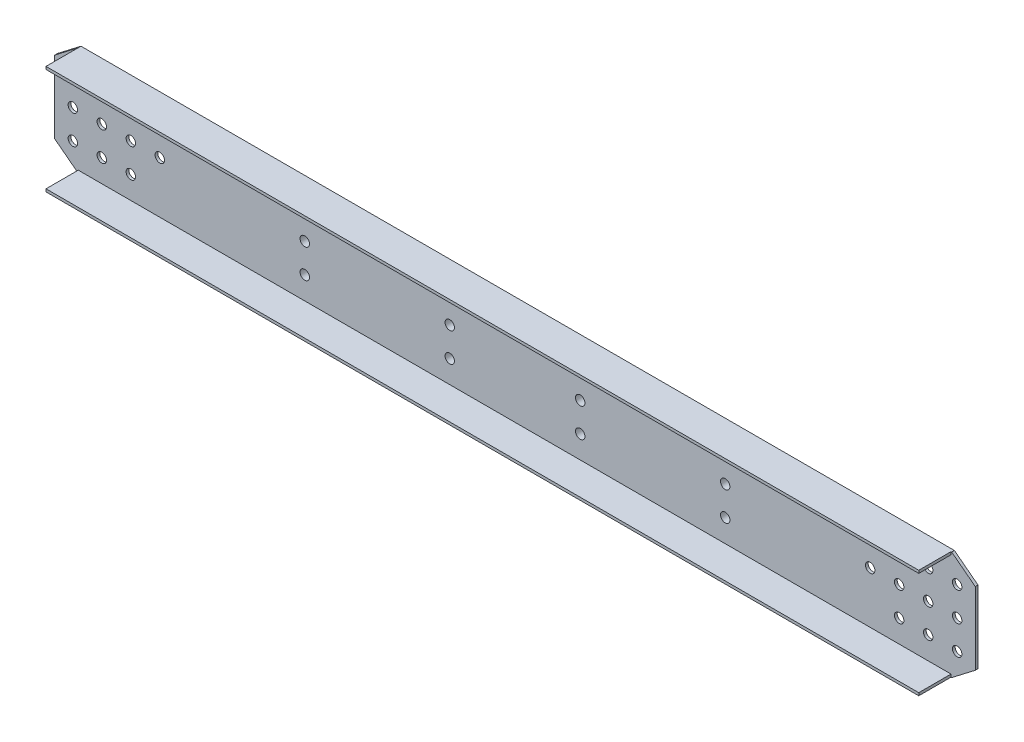
from build123d import *

# Parameters (mm, degrees)
SKETCH_1_R          = 13
EXTRUDE_637_DEPTH   = 7.5
SKETCH_2_W          = 2408.049034164
SKETCH_2_H          = 7.5
EXTRUDE_1_DEPTH     = 89
SKETCH_3_W          = 80
SKETCH_3_H          = 240
EXTRUDE_2_DEPTH     = 16
SKETCH_4_R          = 13
CUT_EXTRUDE_1_DEPTH = 1308.983562588


with BuildPart() as part:
    # 草图1 → Extrude 637 (new body)
    with BuildSketch(Plane.XY):
        Polygon((-1205, 0), (1205, 0), (1270, 50), (1270, 250), (1205, 300), (-1205, 300), (-1270, 250), (-1270, 50), align=None)
        with Locations((-1220, 230)):
            Circle(SKETCH_1_R, mode=Mode.SUBTRACT)
        with Locations((-1220, 150)):
            Circle(SKETCH_1_R, mode=Mode.SUBTRACT)
        with Locations((-1140, 230)):
            Circle(SKETCH_1_R, mode=Mode.SUBTRACT)
        with Locations((-1140, 150)):
            Circle(SKETCH_1_R, mode=Mode.SUBTRACT)
        with Locations((-1060, 230)):
            Circle(SKETCH_1_R, mode=Mode.SUBTRACT)
        with Locations((-1060, 150)):
            Circle(SKETCH_1_R, mode=Mode.SUBTRACT)
        with Locations((-980, 150)):
            Circle(SKETCH_1_R, mode=Mode.SUBTRACT)
        with Locations((-1060, 70)):
            Circle(SKETCH_1_R, mode=Mode.SUBTRACT)
        with Locations((-1140, 70)):
            Circle(SKETCH_1_R, mode=Mode.SUBTRACT)
        with Locations((-1220, 70)):
            Circle(SKETCH_1_R, mode=Mode.SUBTRACT)
        with Locations((1220, 70)):
            Circle(SKETCH_1_R, mode=Mode.SUBTRACT)
        with Locations((1140, 70)):
            Circle(SKETCH_1_R, mode=Mode.SUBTRACT)
        with Locations((1060, 70)):
            Circle(SKETCH_1_R, mode=Mode.SUBTRACT)
        with Locations((980, 150)):
            Circle(SKETCH_1_R, mode=Mode.SUBTRACT)
        with Locations((1060, 150)):
            Circle(SKETCH_1_R, mode=Mode.SUBTRACT)
        with Locations((1060, 230)):
            Circle(SKETCH_1_R, mode=Mode.SUBTRACT)
        with Locations((1140, 150)):
            Circle(SKETCH_1_R, mode=Mode.SUBTRACT)
        with Locations((1140, 230)):
            Circle(SKETCH_1_R, mode=Mode.SUBTRACT)
        with Locations((1220, 150)):
            Circle(SKETCH_1_R, mode=Mode.SUBTRACT)
        with Locations((1220, 230)):
            Circle(SKETCH_1_R, mode=Mode.SUBTRACT)
    extrude(amount=-EXTRUDE_637_DEPTH)

    # 草图2 → 凸台-拉伸1 (add)
    with BuildSketch(Plane.XY):
        with Locations((-0.975482918, 296.25)):
            Rectangle(SKETCH_2_W, SKETCH_2_H)
        with Locations((-0.975482918, 3.75)):
            Rectangle(SKETCH_2_W, SKETCH_2_H)
    extrude(amount=EXTRUDE_1_DEPTH)

    # 草图3 → 凸台-拉伸2 (add)
    with BuildSketch(Plane(origin=(0, 0, -7.5), x_dir=(-1, 0, 0), z_dir=(0, 0, -1))):
        with Locations((-580, 150)):
            Rectangle(SKETCH_3_W, SKETCH_3_H)
        with Locations((-180, 150)):
            Rectangle(SKETCH_3_W, SKETCH_3_H)
        with Locations((180, 150)):
            Rectangle(SKETCH_3_W, SKETCH_3_H)
        with Locations((580, 150)):
            Rectangle(SKETCH_3_W, SKETCH_3_H)
    extrude(amount=EXTRUDE_2_DEPTH)

    # 草图4 → 切除-拉伸1 (cut, through all)
    with BuildSketch(Plane.XY):
        with Locations((-580, 230)):
            Circle(SKETCH_4_R)
        with Locations((-580, 150)):
            Circle(SKETCH_4_R)
        with Locations((-180, 230)):
            Circle(SKETCH_4_R)
        with Locations((-180, 150)):
            Circle(SKETCH_4_R)
        with Locations((-180, 70)):
            Circle(SKETCH_4_R)
        with Locations((-580, 70)):
            Circle(SKETCH_4_R)
        with Locations((580, 70)):
            Circle(SKETCH_4_R)
        with Locations((180, 70)):
            Circle(SKETCH_4_R)
        with Locations((180, 150)):
            Circle(SKETCH_4_R)
        with Locations((180, 230)):
            Circle(SKETCH_4_R)
        with Locations((580, 150)):
            Circle(SKETCH_4_R)
        with Locations((580, 230)):
            Circle(SKETCH_4_R)
    extrude(amount=-CUT_EXTRUDE_1_DEPTH, mode=Mode.SUBTRACT)


solid = part.part
